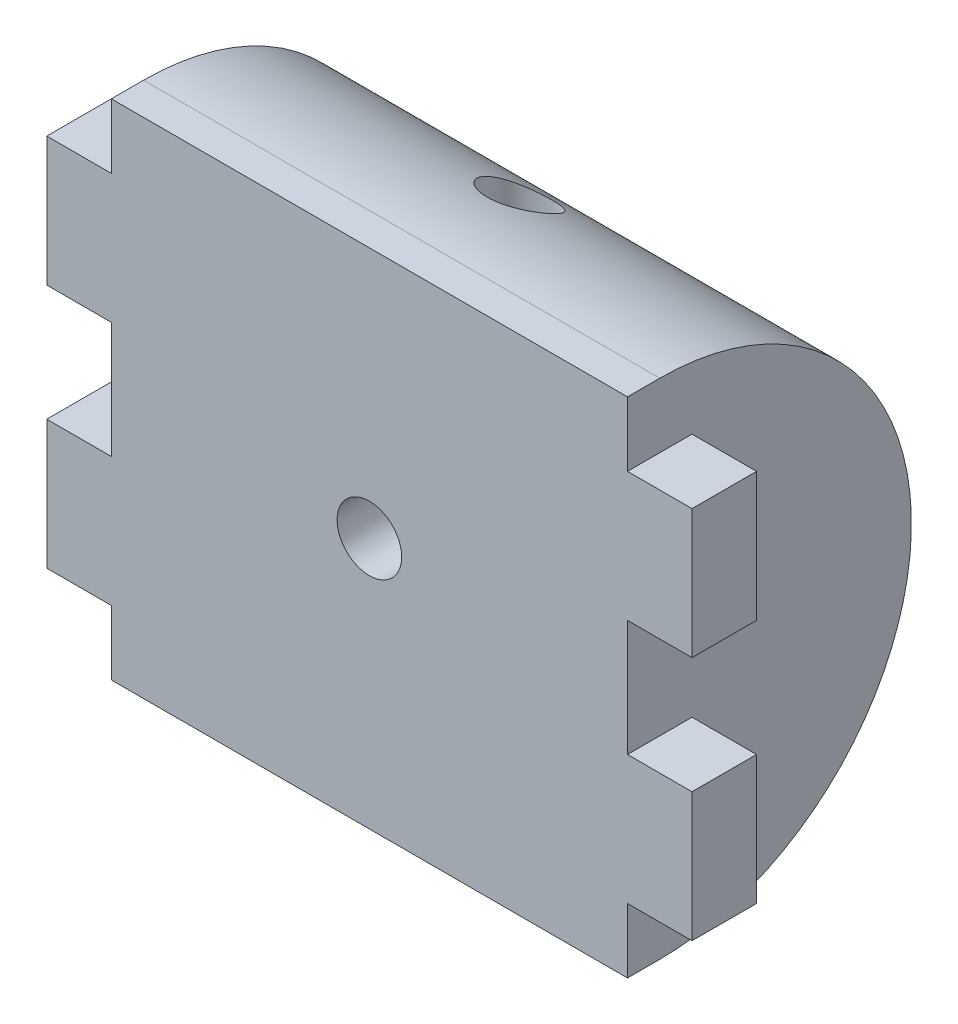
from build123d import *

# Parameters (mm, degrees)
SKETCH1_R            = 2.5
BOSS_EXTRUDE1_DEPTH  = 5
SKETCH39_W           = 40
SKETCH39_H           = 39
SKETCH39_R           = 10
BOSS_EXTRUDE13_DEPTH = 17
CUT_EXTRUDE10_DEPTH  = 57
SKETCH41_R           = 10
SKETCH41_R_2         = 2.3
BOSS_EXTRUDE14_DEPTH = 3
SKETCH42_R           = 2.5
CUT_EXTRUDE14_DEPTH  = 19


with BuildPart() as part:
    # Sketch1 → Boss-Extrude1 (new body)
    with BuildSketch(Plane.XY):
        Polygon((-25, 14.5), (-20, 14.5), (-20, 19.5), (20, 19.5), (20, 14.5), (25, 14.5), (25, 4.5), (20, 4.5), (20, -4.5), (25, -4.5), (25, -14.5), (20, -14.5), (20, -19.5), (-20, -19.5), (-20, -14.5), (-25, -14.5), (-25, -4.5), (-20, -4.5), (-20, 4.5), (-25, 4.5), align=None)
        Circle(SKETCH1_R, mode=Mode.SUBTRACT)
    extrude(amount=BOSS_EXTRUDE1_DEPTH)

    # Sketch39 → Boss-Extrude13 (add)
    with BuildSketch(Plane(origin=(0, 0, 0), x_dir=(-1, 0, 0), z_dir=(0, 0, -1))):
        Rectangle(SKETCH39_W, SKETCH39_H)
        Circle(SKETCH39_R, mode=Mode.SUBTRACT)
    extrude(amount=BOSS_EXTRUDE13_DEPTH)

    # Sketch40 → Cut-Extrude10 (cut)
    with BuildSketch(Plane(origin=(20, 0, 0), x_dir=(0, 0, -1), z_dir=(1, 0, 0))):
        with BuildLine():
            Line((17, 19.5), (-2.5, 19.5))
            ThreePointArc((-2.5, 19.5), (11.288582228, 13.788582238), (17, 1.4e-08))
            Line((17, 1.4e-08), (17, 19.5))
        make_face()
        with BuildLine():
            ThreePointArc((17, 1.4e-08), (11.288582238, -13.788582228), (-2.5, -19.5))
            Line((-2.5, -19.5), (17, -19.5))
            Line((17, -19.5), (17, 1.4e-08))
        make_face()
    extrude(amount=-CUT_EXTRUDE10_DEPTH, mode=Mode.SUBTRACT)

    # Sketch41 → Boss-Extrude14 (add)
    with BuildSketch(Plane(origin=(0, 0, 0), x_dir=(-1, 0, 0), z_dir=(0, 0, -1))):
        Circle(SKETCH41_R)
        Circle(SKETCH41_R_2, mode=Mode.SUBTRACT)
    extrude(amount=BOSS_EXTRUDE14_DEPTH)

    # Sketch42 → Cut-Extrude14 (cut, symmetric)
    with BuildSketch(Plane(origin=(0, 0, 0), x_dir=(-1, 0, 0), z_dir=(0, -1, 0))):
        with Locations((0, 6.629082055)):
            Circle(SKETCH42_R)
    extrude(amount=CUT_EXTRUDE14_DEPTH, both=True, mode=Mode.SUBTRACT)


solid = part.part
